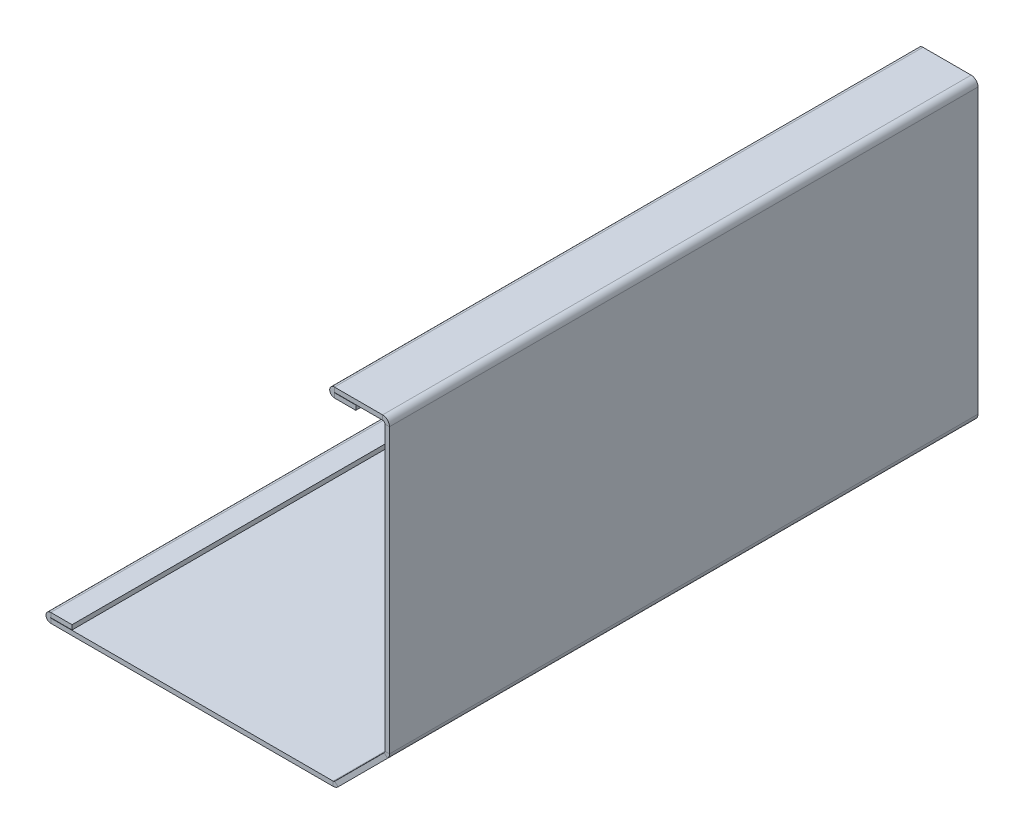
from build123d import *

# Parameters (mm, degrees)
CROQUIS1_W                       = 94
CROQUIS1_H                       = 192
BRIDA_BASE1_DEPTH                = 1.5
BRIDA_DE_ARISTA1_STRIP_CUT_DEPTH = 192
BRIDA_DE_ARISTA1_DEPTH           = 192
BRIDA_DE_ARISTA3_STRIP_CUT_DEPTH = 192
BRIDA_DE_ARISTA3_DEPTH           = 192
BRIDA_DE_ARISTA4_STRIP_W         = 7.4732
BRIDA_DE_ARISTA4_STRIP_H         = 1.5
BRIDA_DE_ARISTA4_STRIP_CUT_DEPTH = 192
BRIDA_DE_ARISTA4_DEPTH           = 192
DOBLADILLO1_START                = -96
DOBLADILLO1_DEPTH                = 192
DOBLADILLO1_2_DEPTH              = 192


# Read off the part's stored shape, not the designer's step: Dobladillo1
# Sheet-metal steps are written as plain solids
with BuildPart() as part:
    # Croquis1 → Brida base1 (new body)
    with BuildSketch(Plane(origin=(0, 0, 0), x_dir=(1, 0, 0), z_dir=(0, 1, 0))):
        Rectangle(CROQUIS1_W, CROQUIS1_H)
    extrude(amount=BRIDA_BASE1_DEPTH)

    # Brida de arista1 strip (across the edge) → Brida de arista1 strip cut (cut)
    with BuildSketch(Plane(origin=(47, 1.5, 96), x_dir=(-0.7071067811865438, 0.7071067811865512, 0), z_dir=(0, 0, -1))):
        Polygon((-6.129265424, 4.00794508), (-0.844915027, -1.276405317), (0.215745145, -0.215745145), (-5.068605252, 5.068605252), align=None)
    extrude(amount=BRIDA_DE_ARISTA1_STRIP_CUT_DEPTH, mode=Mode.SUBTRACT)

    # Brida de arista1 section (across the edge) → Brida de arista1 (add)
    with BuildSketch(Plane(origin=(47, 1.5, 96), x_dir=(-0.7071067811865438, 0.7071067811865512, 0), z_dir=(0, 0, -1))):
        with BuildLine():
            Line((-1.5, 0.30510971), (-1.5, 23.420310217))
            Line((-1.5, 23.420310217), (0, 23.420310217))
            Line((0, 23.420310217), (0, 0.30510971))
            ThreePointArc((0, 0.30510971), (0.056070336, 0.023225094), (0.215745145, -0.215745145))
            Line((0.215745145, -0.215745145), (-0.844915027, -1.276405317))
            ThreePointArc((-0.844915027, -1.276405317), (-1.329748962, -0.550800055), (-1.5, 0.30510971))
        make_face()
    extrude(amount=BRIDA_DE_ARISTA1_DEPTH)

    # Brida de arista3 strip (across the edge) → Brida de arista3 strip cut (cut)
    with BuildSketch(Plane(origin=(63.560660172, 18.060660172, 96), x_dir=(-1, 0, 0), z_dir=(0, 0, -1))):
        Polygon((-6.129265424, 4.00794508), (-0.844915027, -1.276405317), (0.215745145, -0.215745145), (-5.068605252, 5.068605252), align=None)
    extrude(amount=BRIDA_DE_ARISTA3_STRIP_CUT_DEPTH, mode=Mode.SUBTRACT)

    # Brida de arista3 section (across the edge) → Brida de arista3 (add)
    with BuildSketch(Plane(origin=(63.560660172, 18.060660172, 96), x_dir=(-1, 0, 0), z_dir=(0, 0, -1))):
        with BuildLine():
            Line((-1.5, 0.30510971), (-1.5, 94.978679656))
            Line((-1.5, 94.978679656), (0, 94.978679656))
            Line((0, 94.978679656), (0, 0.30510971))
            ThreePointArc((0, 0.30510971), (0.056070336, 0.023225094), (0.215745145, -0.215745145))
            Line((0.215745145, -0.215745145), (-0.844915027, -1.276405317))
            ThreePointArc((-0.844915027, -1.276405317), (-1.329748962, -0.550800055), (-1.5, 0.30510971))
        make_face()
    extrude(amount=BRIDA_DE_ARISTA3_DEPTH)

    # Brida de arista4 strip (across the edge) → Brida de arista4 strip cut (cut)
    with BuildSketch(Plane(origin=(63.560660172, 113.039339828, 96), x_dir=(0, -1, 0), z_dir=(0, 0, -1))):
        with Locations((-1.5, -0.75)):
            Rectangle(BRIDA_DE_ARISTA4_STRIP_W, BRIDA_DE_ARISTA4_STRIP_H)
    extrude(amount=BRIDA_DE_ARISTA4_STRIP_CUT_DEPTH, mode=Mode.SUBTRACT)

    # Brida de arista4 section (across the edge) → Brida de arista4 (add)
    with BuildSketch(Plane(origin=(63.560660172, 113.039339828, 96), x_dir=(0, -1, 0), z_dir=(0, 0, -1))):
        with BuildLine():
            Line((0, 0.7366), (0, 18))
            Line((0, 18), (1.5, 18))
            Line((1.5, 18), (1.5, 0.7366))
            ThreePointArc((1.5, 0.7366), (1.715745145, 0.215745145), (2.2366, 0))
            Line((2.2366, 0), (2.2366, -1.5))
            ThreePointArc((2.2366, -1.5), (0.655084973, -0.844915027), (0, 0.7366))
        make_face()
    extrude(amount=BRIDA_DE_ARISTA4_DEPTH)

    # Dobladillo1 outline → Dobladillo1 (cut)
    with BuildSketch(Plane.XY.offset(DOBLADILLO1_START)):
        with BuildLine():
            Line((45.560660172, 111.539339828), (45.561466834, 111.539339828))
            ThreePointArc((45.561466834, 111.539339828), (46.032467239, 112.602892701), (47.110660172, 113.039339828))
            Line((47.110660172, 113.039339828), (45.560660172, 113.039339828))
            Line((45.560660172, 113.039339828), (45.560660172, 111.539339828))
        make_face()
        with BuildLine():
            ThreePointArc((-45.45, 0), (-46.528192933, 0.436447127), (-46.999193338, 1.5))
            Line((-46.999193338, 1.5), (-47, 1.5))
            Line((-47, 1.5), (-47, 0))
            Line((-47, 0), (-45.45, 0))
        make_face()
    extrude(amount=DOBLADILLO1_DEPTH, mode=Mode.SUBTRACT)

    # Dobladillo1 2 outline → Dobladillo1 2 (add)
    with BuildSketch(Plane.XY.offset(DOBLADILLO1_START)):
        with BuildLine():
            Line((54.060660172, 109.939339828), (54.060660172, 111.439339828))
            Line((54.060660172, 111.439339828), (47.110660172, 111.439339828))
            ThreePointArc((47.110660172, 111.439339828), (47.060660172, 111.489339828), (47.110660172, 111.539339828))
            Line((47.110660172, 111.539339828), (45.561466834, 111.539339828))
            ThreePointArc((45.561466834, 111.539339828), (45.997107299, 110.411146895), (47.110660172, 109.939339828))
            Line((47.110660172, 109.939339828), (54.060660172, 109.939339828))
        make_face()
        with BuildLine():
            Line((-38.5, 1.6), (-38.5, 3.1))
            Line((-38.5, 3.1), (-45.45, 3.1))
            ThreePointArc((-45.45, 3.1), (-46.563552873, 2.628192933), (-46.999193338, 1.5))
            Line((-46.999193338, 1.5), (-45.45, 1.5))
            ThreePointArc((-45.45, 1.5), (-45.5, 1.55), (-45.45, 1.6))
            Line((-45.45, 1.6), (-38.5, 1.6))
        make_face()
    extrude(amount=DOBLADILLO1_2_DEPTH)


solid = part.part
